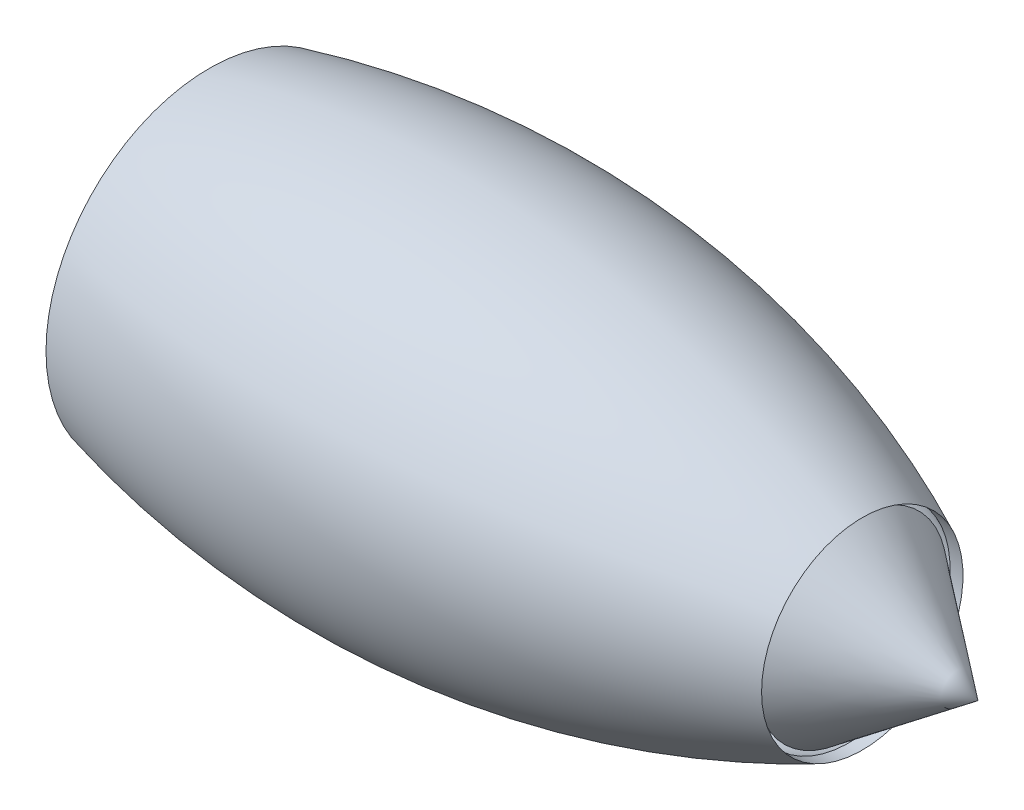
from build123d import *

# Parameters (mm, degrees)
SKETCH2_R          = 57
CUT_EXTRUDE1_DEPTH = 26
SKETCH3_R          = 37
CUT_EXTRUDE2_DEPTH = 50
SCALE1_SCALE       = 3.3


with BuildPart() as part:
    # Sketch1 → Revolve1 (revolve)
    with BuildSketch(Plane(origin=(0, 0, 0), x_dir=(1, 0, 0), z_dir=(0, 1, 0))):
        with BuildLine():
            Line((-100.921149604, 0), (-100.921149604, 60))
            ThreePointArc((-100.921149604, 60), (28.840728929, 68.383904914), (153.078850396, 30))
            Line((153.078850396, 30), (153.078850396, 0))
            Line((153.078850396, 0), (151.078850396, 0))
            Line((151.078850396, 0), (151.078850396, 28.786478804))
            ThreePointArc((151.078850396, 28.786478804), (28.778906645, 66.377262366), (-98.921149604, 58.437559336))
            Line((-98.921149604, 58.437559336), (-98.921149604, 0))
            Line((-98.921149604, 0), (-100.921149604, 0))
        make_face()
    revolve(axis=Axis((151.078850396, 0, 0), (1, 0, 0)))

    # Sketch2 → Cut-Extrude1 (cut)
    with BuildSketch(Plane.ZY.offset(100.921149604)):
        Circle(SKETCH2_R)
    extrude(amount=-CUT_EXTRUDE1_DEPTH, mode=Mode.SUBTRACT)

    # Sketch3 → Cut-Extrude2 (cut)
    with BuildSketch(Plane(origin=(153.078850396, 0, 0), x_dir=(0, 0, -1), z_dir=(1, 0, 0))):
        Circle(SKETCH3_R)
    extrude(amount=-CUT_EXTRUDE2_DEPTH, mode=Mode.SUBTRACT)


with BuildPart() as body_2:
    # Boss-Extrude1 cone 1 section (through the dimple's axis) → Boss-Extrude1 (revolve)
    with BuildSketch(Plane(origin=(135, 0, 0), x_dir=(0, 0, 1), z_dir=(0, 1, 0))):
        Polygon((0, 0), (35, 0), (0, 46.446568757), align=None)
    revolve(axis=Axis((135, 0, 0), (1, 0, 0)))


with BuildPart() as body_2_1:
    # Scale1: scaled about (0, 0, 0)
    add(body_2.part.scale(SCALE1_SCALE))


with BuildPart() as part_1:
    # Scale1: scaled about (0, 0, 0)
    add(part.part.scale(SCALE1_SCALE))


solid = Compound([body_2_1.part, part_1.part])
